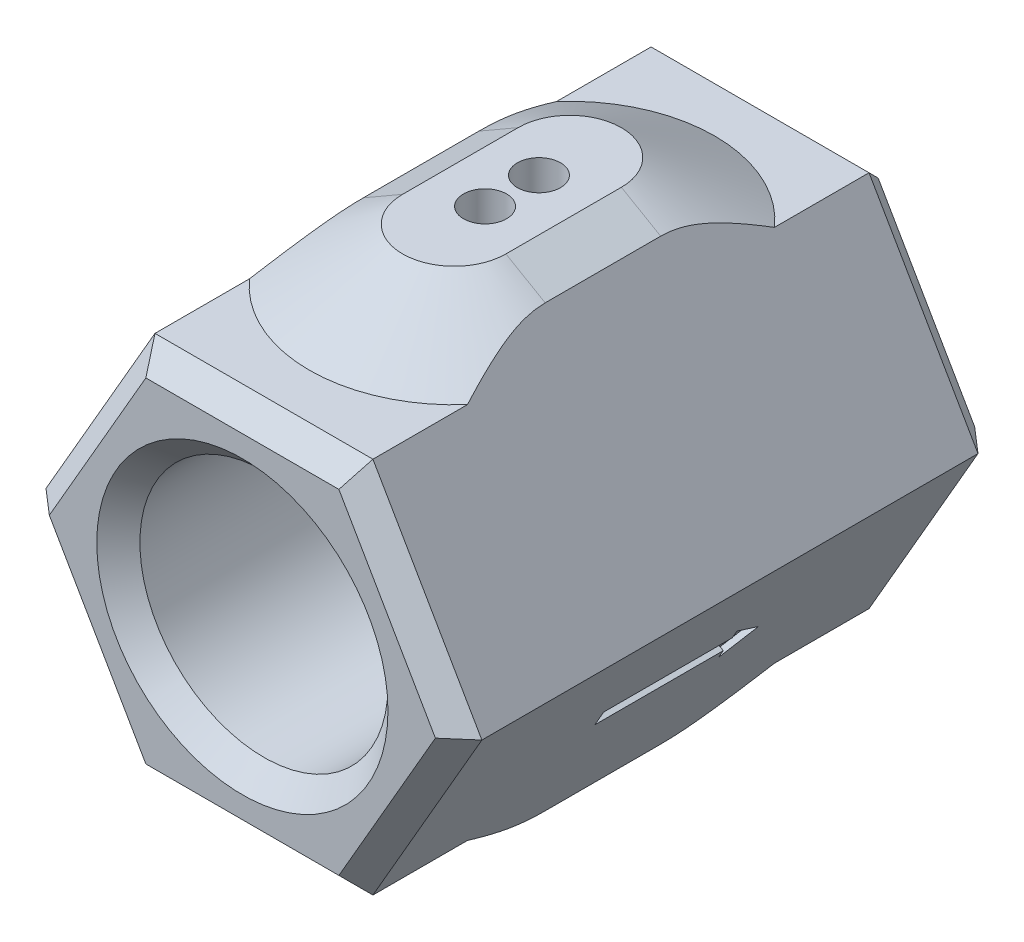
from build123d import *

# Parameters (mm, degrees)
BOSS_EXTRUDE1_DEPTH      = 25
BOSS_EXTRUDE2_DEPTH      = 5
BOSS_EXTRUDE2_DEPTH_BACK = 40
SKETCH6_R                = 2
CUT_EXTRUDE2_DEPTH       = 56.302200077
SKETCH7_R                = 11.5
CUT_EXTRUDE3_DEPTH       = 59.434436194
CHAMFER3_SIZE            = 2
CHAMFER4_SIZE            = 8.660254038
CHAMFER4_SIZE_2          = 5
CUT_EXTRUDE4_DEPTH       = 0.5
CUT_EXTRUDE5_DEPTH       = 0.5


with BuildPart() as part:
    # Sketch1 → Boss-Extrude1 (new, symmetric)
    with BuildSketch(Plane.XY):
        Polygon((10.103629711, 17.5), (-10.103629711, 17.5), (-20.207259422, 0), (-10.103629711, -17.5), (10.103629711, -17.5), (20.207259422, 0), align=None)
    extrude(amount=BOSS_EXTRUDE1_DEPTH, both=True)

    # Sketch2 → Boss-Extrude2 (add, two sides: drawn at the far end of the back side and taken through both)
    with BuildSketch(Plane(origin=(0, 17.5, 0), x_dir=(1, 0, 0), z_dir=(0, 1, 0)).offset(-BOSS_EXTRUDE2_DEPTH_BACK)):
        with BuildLine():
            Line((-4.788486146, -5.353793539), (-4.788486146, 5.353793539))
            ThreePointArc((-4.788486146, 5.353793539), (0, 10.142279685), (4.788486146, 5.353793539))
            Line((4.788486146, 5.353793539), (4.788486146, -5.353793539))
            ThreePointArc((4.788486146, -5.353793539), (0, -10.142279685), (-4.788486146, -5.353793539))
        make_face()
    extrude(amount=BOSS_EXTRUDE2_DEPTH + BOSS_EXTRUDE2_DEPTH_BACK)

    # Sketch6 → Cut-Extrude2 (cut, through all)
    with BuildSketch(Plane(origin=(0, 22.5, 0), x_dir=(1, 0, 0), z_dir=(0, 1, 0))):
        with Locations(Location((0, -2.5, 0), (0, 0, 270))):
            Circle(SKETCH6_R)
        with Locations(Location((0, 2.5, 0), (0, 0, 270))):
            Circle(SKETCH6_R)
    extrude(amount=-CUT_EXTRUDE2_DEPTH, mode=Mode.SUBTRACT)

    # Sketch7 → Cut-Extrude3 (cut, through all)
    with BuildSketch(Plane(origin=(0, 0, -25), x_dir=(-1, 0, 0), z_dir=(0, 0, -1))):
        Circle(SKETCH7_R)
    extrude(amount=-CUT_EXTRUDE3_DEPTH, mode=Mode.SUBTRACT)

    # Chamfer3
    chamfer3_edges = [part.edges().sort_by_distance(p)[0] for p in [
        (-15.155444566, 8.75, 25),
        (-15.155444566, -8.75, 25),
        (0, -17.5, 25),
        (15.155444566, -8.75, 25),
        (15.155444566, 8.75, 25),
        (11.5, 0, 25),
        (11.5, 0, -25),
        (15.155444566, -8.75, -25),
        (0, -17.5, -25),
        (-15.155444566, -8.75, -25),
        (0, 17.5, 25),
        (-15.155444566, 8.75, -25),
        (0, 17.5, -25),
        (15.155444566, 8.75, -25),
    ]]
    chamfer(chamfer3_edges, length=CHAMFER3_SIZE)

    # Chamfer4
    # the kernel refuses this chamfer: 8.660254038, 5 mm, written as the material it adds along each edge
    with BuildSketch(Plane(origin=(4.788486146, -17.5, -5.353793539), x_dir=(0.9998132206222078, 0.019326765612700893, 0), z_dir=(0, 0, 1))) as chamfer4_piece_1_section:
        Polygon((CHAMFER4_SIZE * 0.999813220604, -CHAMFER4_SIZE * 0.0193267656124), (-CHAMFER4_SIZE_2 * 0.0193267656127, -CHAMFER4_SIZE_2 * 0.999813220622), (0, 0), align=None)
    chamfer4_piece_1 = extrude(amount=10.707587077, mode=Mode.PRIVATE)
    chamfer4_piece_1 = split(chamfer4_piece_1, bisect_by=Plane(origin=(8.460633685, -20.345752593, 0), z_dir=(-0.8660254037844387, 0.4999999999999999, 0)), keep=Keep.TOP, mode=Mode.PRIVATE)
    chamfer4_piece_1 = split(chamfer4_piece_1, bisect_by=Plane(origin=(6.722843937, -22.5, 0), z_dir=(0, 1, 0)), keep=Keep.TOP, mode=Mode.PRIVATE)
    add(chamfer4_piece_1)
    with BuildSketch(Plane(origin=(0, -17.5, -5.353793539), x_dir=(-1, 0, 0), z_dir=(0, 0, 1))) as chamfer4_piece_2_section:
        Polygon((4.788486146 + CHAMFER4_SIZE, 0), (4.788486146, CHAMFER4_SIZE_2), (4.788486146, 0), align=None)
    chamfer4_piece_2 = revolve(axis=Axis((0, -17.5, -5.353793539), (0, -1, 0)), revolution_arc=180, mode=Mode.PRIVATE)
    chamfer4_piece_2 = split(chamfer4_piece_2, bisect_by=Plane(origin=(6.935994124, -22.986505777, -10.917233829), z_dir=(-0.8660254037844387, 0.4999999999999999, 0)), keep=Keep.TOP, mode=Mode.PRIVATE)
    chamfer4_piece_2 = split(chamfer4_piece_2, bisect_by=Plane(origin=(-6.935994098, -22.986505822, -10.917233829), z_dir=(0.8660254037844385, 0.5000000000000003, 0)), keep=Keep.TOP, mode=Mode.PRIVATE)
    chamfer4_piece_2 = split(chamfer4_piece_2, bisect_by=Plane(origin=(5.2e-08, -22.5, -10.917233829), z_dir=(0, 1, 0)), keep=Keep.TOP, mode=Mode.PRIVATE)
    add(chamfer4_piece_2)
    with BuildSketch(Plane(origin=(0, -17.5, 5.353793539), x_dir=(1, 0, 0), z_dir=(0, 0, -1))) as chamfer4_piece_3_section:
        Polygon((4.788486146 + CHAMFER4_SIZE, 0), (4.788486146, CHAMFER4_SIZE_2), (4.788486146, 0), align=None)
    chamfer4_piece_3 = revolve(axis=Axis((0, -17.5, 5.353793539), (0, -1, 0)), revolution_arc=180, mode=Mode.PRIVATE)
    chamfer4_piece_3 = split(chamfer4_piece_3, bisect_by=Plane(origin=(6.935994128, -22.98650577, 10.917233836), z_dir=(-0.8660254037844387, 0.4999999999999999, 0)), keep=Keep.TOP, mode=Mode.PRIVATE)
    chamfer4_piece_3 = split(chamfer4_piece_3, bisect_by=Plane(origin=(-6.935994097, -22.986505824, 10.917233836), z_dir=(0.8660254037844385, 0.5000000000000003, 0)), keep=Keep.TOP, mode=Mode.PRIVATE)
    chamfer4_piece_3 = split(chamfer4_piece_3, bisect_by=Plane(origin=(6.2e-08, -22.5, 10.917233836), z_dir=(0, 1, 0)), keep=Keep.TOP, mode=Mode.PRIVATE)
    add(chamfer4_piece_3)
    with BuildSketch(Plane(origin=(-4.788486146, -17.5, 5.353793539), x_dir=(-0.999813220622208, 0.019326765612700497, 0), z_dir=(0, 0, -1))) as chamfer4_piece_4_section:
        Polygon((CHAMFER4_SIZE * 0.999813220604, -CHAMFER4_SIZE * 0.0193267656124), (-CHAMFER4_SIZE_2 * 0.0193267656127, -CHAMFER4_SIZE_2 * 0.999813220622), (0, 0), align=None)
    chamfer4_piece_4 = extrude(amount=10.707587077, mode=Mode.PRIVATE)
    chamfer4_piece_4 = split(chamfer4_piece_4, bisect_by=Plane(origin=(-8.460633685, -20.345752593, 0), z_dir=(0.8660254037844385, 0.5000000000000003, 0)), keep=Keep.TOP, mode=Mode.PRIVATE)
    chamfer4_piece_4 = split(chamfer4_piece_4, bisect_by=Plane(origin=(-6.722843937, -22.5, 0), z_dir=(0, 1, 0)), keep=Keep.TOP, mode=Mode.PRIVATE)
    add(chamfer4_piece_4)
    with BuildSketch(Plane(origin=(-4.788486146, 17.5, -5.353793539), x_dir=(-0.999813220622208, -0.019326765612700497, 0), z_dir=(0, 0, 1))) as chamfer4_piece_5_section:
        Polygon((CHAMFER4_SIZE * 0.999813220604, -CHAMFER4_SIZE * 0.0193267656124), (-CHAMFER4_SIZE_2 * 0.0193267656127, -CHAMFER4_SIZE_2 * 0.999813220622), (0, 0), align=None)
    chamfer4_piece_5 = extrude(amount=10.707587077, mode=Mode.PRIVATE)
    chamfer4_piece_5 = split(chamfer4_piece_5, bisect_by=Plane(origin=(-8.460633685, 20.345752593, 0), z_dir=(0.8660254037844388, -0.49999999999999983, 0)), keep=Keep.TOP, mode=Mode.PRIVATE)
    chamfer4_piece_5 = split(chamfer4_piece_5, bisect_by=Plane(origin=(-6.722843937, 22.5, 0), z_dir=(0, -1, 0)), keep=Keep.TOP, mode=Mode.PRIVATE)
    add(chamfer4_piece_5)
    with BuildSketch(Plane(origin=(0, 17.5, 5.353793539), x_dir=(1, 0, 0), z_dir=(0, 0, -1))) as chamfer4_piece_6_section:
        Polygon((4.788486146 + CHAMFER4_SIZE, 0), (4.788486146, -CHAMFER4_SIZE_2), (4.788486146, 0), align=None)
    chamfer4_piece_6 = revolve(axis=Axis((0, 17.5, 5.353793539), (0, -1, 0)), revolution_arc=180, mode=Mode.PRIVATE)
    chamfer4_piece_6 = split(chamfer4_piece_6, bisect_by=Plane(origin=(6.935994103, 22.986505812, 10.917233841), z_dir=(-0.8660254037844387, -0.5000000000000003, 0)), keep=Keep.TOP, mode=Mode.PRIVATE)
    chamfer4_piece_6 = split(chamfer4_piece_6, bisect_by=Plane(origin=(-6.935994125, 22.986505774, 10.917233841), z_dir=(0.8660254037844388, -0.49999999999999983, 0)), keep=Keep.TOP, mode=Mode.PRIVATE)
    chamfer4_piece_6 = split(chamfer4_piece_6, bisect_by=Plane(origin=(-4.4e-08, 22.5, 10.917233841), z_dir=(0, -1, 0)), keep=Keep.TOP, mode=Mode.PRIVATE)
    add(chamfer4_piece_6)
    with BuildSketch(Plane(origin=(0, 17.5, -5.353793539), x_dir=(-1, 0, 0), z_dir=(0, 0, 1))) as chamfer4_piece_7_section:
        Polygon((4.788486146 + CHAMFER4_SIZE, 0), (4.788486146, -CHAMFER4_SIZE_2), (4.788486146, 0), align=None)
    chamfer4_piece_7 = revolve(axis=Axis((0, 17.5, -5.353793539), (0, -1, 0)), revolution_arc=180, mode=Mode.PRIVATE)
    chamfer4_piece_7 = split(chamfer4_piece_7, bisect_by=Plane(origin=(6.935994097, 22.986505823, -10.917233827), z_dir=(-0.8660254037844387, -0.5000000000000003, 0)), keep=Keep.TOP, mode=Mode.PRIVATE)
    chamfer4_piece_7 = split(chamfer4_piece_7, bisect_by=Plane(origin=(-6.93599412, 22.986505784, -10.917233827), z_dir=(0.8660254037844388, -0.49999999999999983, 0)), keep=Keep.TOP, mode=Mode.PRIVATE)
    chamfer4_piece_7 = split(chamfer4_piece_7, bisect_by=Plane(origin=(-4.6e-08, 22.5, -10.917233827), z_dir=(0, -1, 0)), keep=Keep.TOP, mode=Mode.PRIVATE)
    add(chamfer4_piece_7)
    with BuildSketch(Plane(origin=(4.788486146, 17.5, 5.353793539), x_dir=(0.999813220622208, -0.019326765612700497, 0), z_dir=(0, 0, -1))) as chamfer4_piece_8_section:
        Polygon((CHAMFER4_SIZE * 0.999813220604, -CHAMFER4_SIZE * 0.0193267656124), (-CHAMFER4_SIZE_2 * 0.0193267656127, -CHAMFER4_SIZE_2 * 0.999813220622), (0, 0), align=None)
    chamfer4_piece_8 = extrude(amount=10.707587077, mode=Mode.PRIVATE)
    chamfer4_piece_8 = split(chamfer4_piece_8, bisect_by=Plane(origin=(8.460633685, 20.345752593, 0), z_dir=(-0.8660254037844387, -0.5000000000000003, 0)), keep=Keep.TOP, mode=Mode.PRIVATE)
    chamfer4_piece_8 = split(chamfer4_piece_8, bisect_by=Plane(origin=(6.722843937, 22.5, 0), z_dir=(0, -1, 0)), keep=Keep.TOP, mode=Mode.PRIVATE)
    add(chamfer4_piece_8)

    # Sketch8 → Cut-Extrude4 (cut)
    with BuildSketch(Plane(origin=(15.155444566, -8.75, 0), x_dir=(0, 0, -1), z_dir=(0.8660254037844387, -0.49999999999999983, 0))):
        Polygon((4.862923627, 0.810905121), (4.862923627, 1.689163545), (7.714387746, -0.02362609), (4.862923627, -1.736415726), (4.862923627, -0.858157301), (-7.055157189, -0.858157301), (-7.055157189, 0.810905121), align=None)
    extrude(amount=-CUT_EXTRUDE4_DEPTH, mode=Mode.SUBTRACT)

    # Sketch9 → Cut-Extrude5 (cut)
    with BuildSketch(Plane(origin=(-15.155444566, 8.75, 0), x_dir=(0, 0, 1), z_dir=(-0.8660254037844389, 0.49999999999999983, 0))):
        Polygon((-4.515922363, -0.834531211), (-4.515922363, -1.712789635), (-7.367386481, 0), (-4.515922363, 1.712789635), (-4.515922363, 0.834531211), (7.402158453, 0.834531211), (7.402158453, -0.834531211), align=None)
    extrude(amount=-CUT_EXTRUDE5_DEPTH, mode=Mode.SUBTRACT)


solid = part.part
